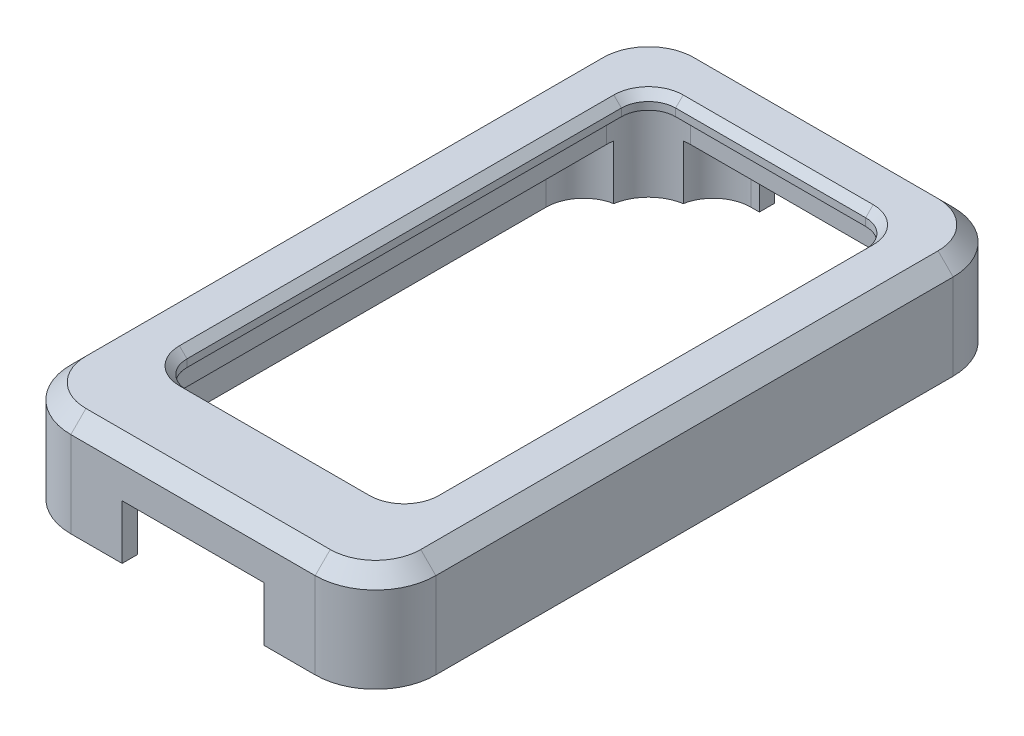
from build123d import *

# Parameters (mm, degrees)
SKETCH_1_W          = 24.2
SKETCH_1_H          = 42.3
EXTRUDE_1_DEPTH     = 6.7
FILLET_1_R          = 4
CUT_EXTRUDE_1_DEPTH = 5.7
CUT_EXTRUDE_2_DEPTH = 26.024438056
CHAMFER_1_SIZE      = 0.5
CHAMFER_2_SIZE      = 1
CUT_EXTRUDE_3_DEPTH = 3.6
EXTRUDE_START       = 3.6
EXTRUDE_2_DEPTH     = 3.6
CUT_EXTRUDE_5_DEPTH = 2.1
FILLET_4_R          = 2.5
M2X0_4_3_D          = 1.6
M2X0_4_3_DEPTH      = 5.019311505
M2X0_4_3_TIP        = 0.480688495
SKETCH_14_W         = 7.5
SKETCH_14_H         = 1
CUT_EXTRUDE_6_DEPTH = 3.6
SKETCH_15_W         = 9.4
SKETCH_15_H         = 1.594635817
CUT_EXTRUDE_7_DEPTH = 3.6


with BuildPart() as part:
    # 草图1 → 凸台-拉伸1 (new body)
    with BuildSketch(Plane(origin=(0, 0, 0), x_dir=(1, 0, 0), z_dir=(0, 1, 0))):
        Rectangle(SKETCH_1_W, SKETCH_1_H)
    extrude(amount=EXTRUDE_1_DEPTH)

    # 圆角1
    fillet_1_edges = [part.edges().sort_by_distance(p)[0] for p in [
        (12.1, 3.35, 21.15),
        (-12.1, 3.35, 21.15),
        (-12.1, 3.35, -21.15),
        (12.1, 3.35, -21.15),
    ]]
    fillet(fillet_1_edges, radius=FILLET_1_R)

    # 草图2 → 切除-拉伸1 (cut)
    with BuildSketch(Plane.XZ):
        with BuildLine():
            Line((-6.3, -18.15), (6.3, -18.15))
            ThreePointArc((6.3, -18.15), (8.279898987, -17.329898987), (9.1, -15.35))
            Line((9.1, -15.35), (9.1, 15.35))
            ThreePointArc((9.1, 15.35), (8.279898987, 17.329898987), (6.3, 18.15))
            Line((6.3, 18.15), (-6.3, 18.15))
            ThreePointArc((-6.3, 18.15), (-8.279898987, 17.329898987), (-9.1, 15.35))
            Line((-9.1, 15.35), (-9.1, -15.35))
            ThreePointArc((-9.1, -15.35), (-8.279898987, -17.329898987), (-6.3, -18.15))
        make_face()
    extrude(amount=-CUT_EXTRUDE_1_DEPTH, mode=Mode.SUBTRACT)

    # 草图3 → 切除-拉伸2 (cut, through all)
    with BuildSketch(Plane.XZ.offset(-5.7)):
        with BuildLine():
            Line((-6.3, -17.15), (6.3, -17.15))
            ThreePointArc((6.3, -17.15), (7.572792206, -16.622792206), (8.1, -15.35))
            Line((8.1, -15.35), (8.1, 13.45))
            ThreePointArc((8.1, 13.45), (7.572792206, 14.722792206), (6.3, 15.25))
            Line((6.3, 15.25), (-6.3, 15.25))
            ThreePointArc((-6.3, 15.25), (-7.572792206, 14.722792206), (-8.1, 13.45))
            Line((-8.1, 13.45), (-8.1, -15.35))
            ThreePointArc((-8.1, -15.35), (-7.572792206, -16.622792206), (-6.3, -17.15))
        make_face()
    extrude(amount=-CUT_EXTRUDE_2_DEPTH, mode=Mode.SUBTRACT)

    # 倒角1
    chamfer_1_edges = [part.edges().sort_by_distance(p)[0] for p in [
        (-7.572792206, 6.7, 14.722792206),
        (0, 6.7, 15.25),
        (7.572792206, 6.7, 14.722792206),
        (8.1, 6.7, -0.95),
        (7.572792206, 6.7, -16.622792206),
        (0, 6.7, -17.15),
        (-7.572792206, 6.7, -16.622792206),
        (-8.1, 6.7, -0.95),
    ]]
    chamfer(chamfer_1_edges, length=CHAMFER_1_SIZE)

    # 倒角2
    chamfer_2_edges = [part.edges().sort_by_distance(p)[0] for p in [
        (12.1, 6.7, 0),
        (0, 6.7, 21.15),
        (0, 6.7, -21.15),
        (-12.1, 6.7, 0),
        (-10.928427125, 6.7, 19.978427125),
        (10.928427125, 6.7, -19.978427125),
        (-10.928427125, 6.7, -19.978427125),
        (10.928427125, 6.7, 19.978427125),
    ]]
    chamfer(chamfer_2_edges, length=CHAMFER_2_SIZE)

    # 草图4 → 切除-拉伸3 (cut)
    with BuildSketch(Plane.XZ):
        with BuildLine():
            Line((11.1, -17.15), (11.1, 17.15))
            ThreePointArc((11.1, 17.15), (10.221320344, 19.271320344), (8.1, 20.15))
            Line((8.1, 20.15), (-8.1, 20.15))
            ThreePointArc((-8.1, 20.15), (-10.221320344, 19.271320344), (-11.1, 17.15))
            Line((-11.1, 17.15), (-11.1, -17.15))
            ThreePointArc((-11.1, -17.15), (-10.221320344, -19.271320344), (-8.1, -20.15))
            Line((-8.1, -20.15), (8.1, -20.15))
            ThreePointArc((8.1, -20.15), (10.221320344, -19.271320344), (11.1, -17.15))
        make_face()
    extrude(amount=-CUT_EXTRUDE_3_DEPTH, mode=Mode.SUBTRACT)

    # 草图7 → 凸台-拉伸2 (add)
    with BuildSketch(Plane.XZ.offset(-3.6).offset(EXTRUDE_START)):
        with BuildLine():
            Line((6.758096095, 20.15), (8.1, 20.15))
            ThreePointArc((8.1, 20.15), (10.221320344, 19.271320344), (11.1, 17.15))
            Line((11.1, 17.15), (11.1, 15.808096095))
            Line((11.1, 15.808096095), (9.062272247, 15.808096095))
            ThreePointArc((9.062272247, 15.808096095), (8.279898987, 17.329898987), (6.758096095, 18.112272247))
            Line((6.758096095, 18.112272247), (6.758096095, 20.15))
        make_face()
        with BuildLine():
            Line((-6.758096095, 20.15), (-8.1, 20.15))
            ThreePointArc((-8.1, 20.15), (-10.221320344, 19.271320344), (-11.1, 17.15))
            Line((-11.1, 17.15), (-11.1, 15.808096095))
            Line((-11.1, 15.808096095), (-9.062272247, 15.808096095))
            ThreePointArc((-9.062272247, 15.808096095), (-8.279898987, 17.329898987), (-6.758096095, 18.112272247))
            Line((-6.758096095, 18.112272247), (-6.758096095, 20.15))
        make_face()
        with BuildLine():
            Line((-8.1, -20.15), (-6.758096095, -20.15))
            Line((-6.758096095, -20.15), (-6.758096095, -18.112272247))
            ThreePointArc((-6.758096095, -18.112272247), (-8.279898987, -17.329898987), (-9.062272247, -15.808096095))
            Line((-9.062272247, -15.808096095), (-11.1, -15.808096095))
            Line((-11.1, -15.808096095), (-11.1, -17.15))
            ThreePointArc((-11.1, -17.15), (-10.221320344, -19.271320344), (-8.1, -20.15))
        make_face()
        with BuildLine():
            Line((11.1, -17.15), (11.1, -15.808096095))
            Line((11.1, -15.808096095), (9.062272247, -15.808096095))
            ThreePointArc((9.062272247, -15.808096095), (8.279898987, -17.329898987), (6.758096095, -18.112272247))
            Line((6.758096095, -18.112272247), (6.758096095, -20.15))
            Line((6.758096095, -20.15), (8.1, -20.15))
            ThreePointArc((8.1, -20.15), (10.221320344, -19.271320344), (11.1, -17.15))
        make_face()
    extrude(amount=-EXTRUDE_2_DEPTH)

    # 草图13 → 切除-拉伸5 (cut)
    with BuildSketch(Plane.XZ.offset(-3.6)):
        with BuildLine():
            Line((6.758096095, 18.112272247), (6.758096095, 20.15))
            Line((6.758096095, 20.15), (-6.758096095, 20.15))
            Line((-6.758096095, 20.15), (-6.758096095, 18.112272247))
            ThreePointArc((-6.758096095, 18.112272247), (-6.529823528, 18.140552122), (-6.3, 18.15))
            Line((-6.3, 18.15), (6.3, 18.15))
            ThreePointArc((6.3, 18.15), (6.529823528, 18.140552122), (6.758096095, 18.112272247))
        make_face()
    extrude(amount=-CUT_EXTRUDE_5_DEPTH, mode=Mode.SUBTRACT)

    # 圆角4
    # the kernel refuses this fillet: 2.5 mm, written as the material it adds along each edge
    with BuildSketch(Plane(origin=(-11.1, 0, 15.808096095), x_dir=(0, 0, -1), z_dir=(0, 1, 0)), Plane(origin=(11.1, 0, -15.808096095), x_dir=(0, 0, 1), z_dir=(0, 1, 0)), Plane(origin=(-6.758096095, 0, -20.15), x_dir=(1, 0, 0), z_dir=(0, 1, 0))) as fillet_4_piece_1:
        with BuildLine():
            CenterArc((2.456889165, -2.5), FILLET_4_R, 90, 79.34417895)
            Line((0, -2.037727753), (-0.049137783, -2.028482308))
            ThreePointArc((-0.049137783, -2.028482308), (-0.05, -1.018863876), (-0.05, 0))
            Line((-0.05, 0), (0, 0.05))
            Line((0, 0.05), (2.456889165, 0.05))
            Line((2.456889165, 0.05), (2.456889165, 0))
        make_face()
    extrude(amount=3.6)
    with BuildSketch(Plane(origin=(-6.758096095, 0, 20.15), x_dir=(0, 0, -1), z_dir=(0, 1, 0))) as fillet_4_piece_2:
        with BuildLine():
            CenterArc((2.5, -2.456889165), FILLET_4_R, 100.65582105, 79.34417895)
            Line((0, -2.456889165), (-0.05, -2.456889165))
            Line((-0.05, -2.456889165), (-0.05, 0))
            Line((-0.05, 0), (0, 0.05))
            ThreePointArc((0, 0.05), (1.018863876, 0.05), (2.028482308, 0.049137783))
            Line((2.028482308, 0.049137783), (2.037727753, 0))
        make_face()
    extrude(amount=5.7)
    with BuildSketch(Plane(origin=(6.758096095, 0, 20.15), x_dir=(-1, 0, 0), z_dir=(0, 1, 0))) as fillet_4_piece_3:
        with BuildLine():
            CenterArc((2.456889165, -2.5), FILLET_4_R, 90, 79.34417895)
            Line((0, -2.037727753), (-0.049137783, -2.028482308))
            ThreePointArc((-0.049137783, -2.028482308), (-0.05, -1.018863876), (-0.05, 0))
            Line((-0.05, 0), (0, 0.05))
            Line((0, 0.05), (2.456889165, 0.05))
            Line((2.456889165, 0.05), (2.456889165, 0))
        make_face()
    extrude(amount=5.7)
    with BuildSketch(Plane(origin=(11.1, 0, 15.808096095), x_dir=(-1, 0, 0), z_dir=(0, 1, 0)), Plane(origin=(-11.1, 0, -15.808096095), x_dir=(1, 0, 0), z_dir=(0, 1, 0)), Plane(origin=(6.758096095, 0, -20.15), x_dir=(0, 0, 1), z_dir=(0, 1, 0))) as fillet_4_piece_4:
        with BuildLine():
            CenterArc((2.5, -2.456889165), FILLET_4_R, 100.65582105, 79.34417895)
            Line((0, -2.456889165), (-0.05, -2.456889165))
            Line((-0.05, -2.456889165), (-0.05, 0))
            Line((-0.05, 0), (0, 0.05))
            ThreePointArc((0, 0.05), (1.018863876, 0.05), (2.028482308, 0.049137783))
            Line((2.028482308, 0.049137783), (2.037727753, 0))
        make_face()
    extrude(amount=3.6)

    # M2x0.4 螺纹孔3
    with Locations(Plane(origin=(0, 0, 0), x_dir=(-1, 0, 0), z_dir=(0, -1, 0))):
        with Locations((-9.6, 18.65), (9.6, 18.65), (9.6, -18.65), (-9.6, -18.65)):
            Hole(M2X0_4_3_D / 2, depth=M2X0_4_3_DEPTH)
            with Locations((0, 0, -(M2X0_4_3_DEPTH + M2X0_4_3_TIP / 2))):  # 118° drill point
                Cone(0, M2X0_4_3_D / 2, M2X0_4_3_TIP, mode=Mode.SUBTRACT)

    # 草图14 → 切除-拉伸6 (cut)
    with BuildSketch(Plane.XZ):
        with Locations((0, -20.65)):
            Rectangle(SKETCH_14_W, SKETCH_14_H)
    extrude(amount=-CUT_EXTRUDE_6_DEPTH, mode=Mode.SUBTRACT)

    # 草图15 → 切除-拉伸7 (cut)
    with BuildSketch(Plane.XZ):
        with Locations((0, 20.352682092)):
            Rectangle(SKETCH_15_W, SKETCH_15_H)
    extrude(amount=-CUT_EXTRUDE_7_DEPTH, mode=Mode.SUBTRACT)


solid = part.part
